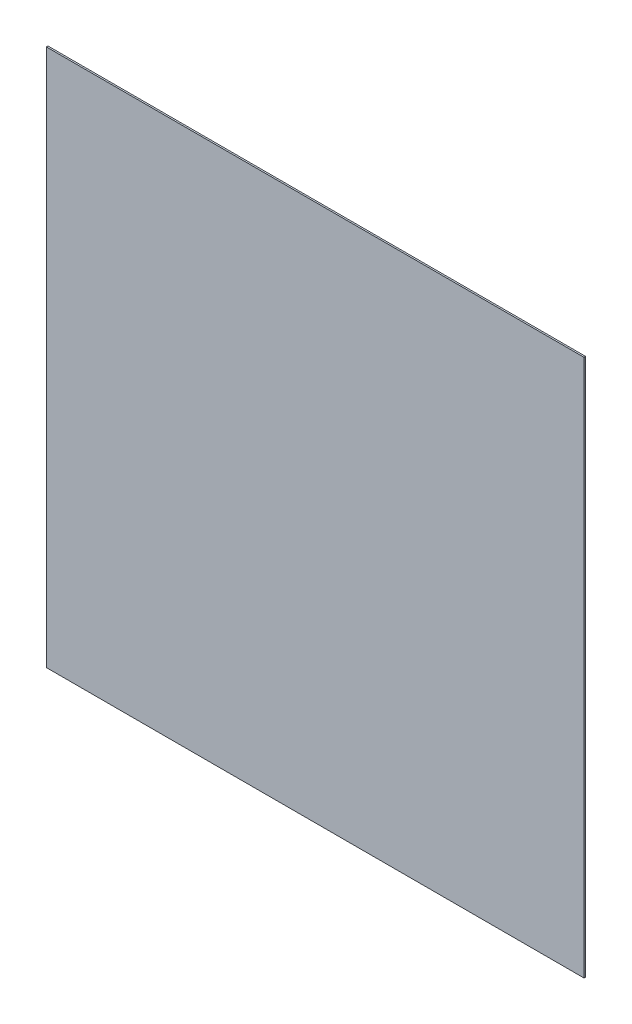
from build123d import *

# Parameters (mm, degrees)
SKETCH1_W           = 400
SKETCH1_H           = 400
BOSS_EXTRUDE1_DEPTH = 1.2


with BuildPart() as part:
    # Sketch1 → Boss-Extrude1 (new body)
    with BuildSketch(Plane.XY):
        with Locations((-187.3, 174.6)):
            Rectangle(SKETCH1_W, SKETCH1_H)
    extrude(amount=BOSS_EXTRUDE1_DEPTH)


solid = part.part
